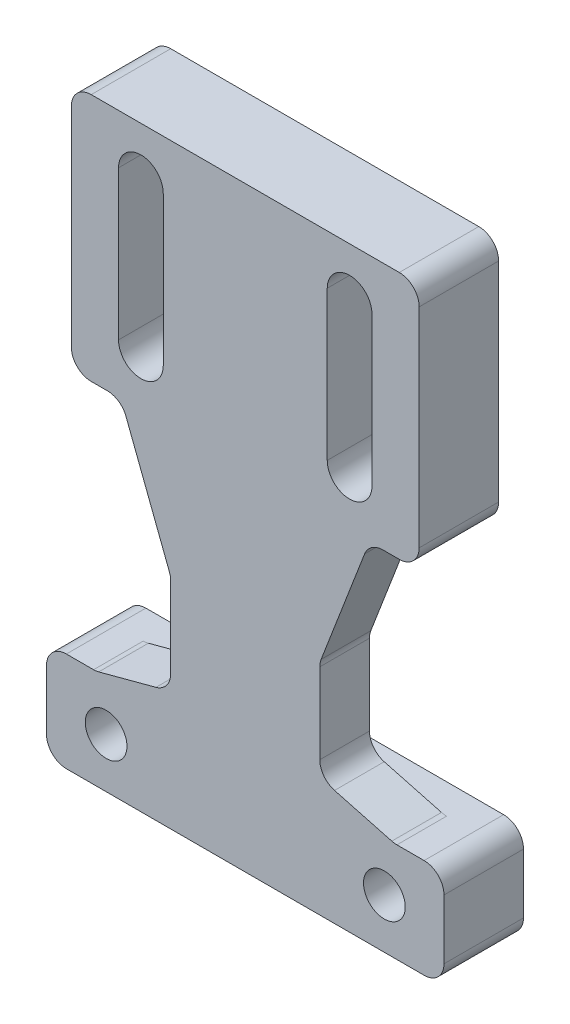
from build123d import *

# Parameters (mm, degrees)
EXTRUDE_1_DEPTH     = 8
FILLET_3_R          = 2
SKETCH_3_W          = 50
SKETCH_3_H          = 25
CUT_EXTRUDE_1_DEPTH = 3
M5X0_81_D           = 4.2
CUT_EXTRUDE_3_DEPTH = 73.553428589


with BuildPart() as part:
    # Эскиз2 → Бобышка-Вытянуть1 (new body)
    with BuildSketch(Plane.XY):
        Polygon((0, 0), (40, 0), (40, 10), (35, 10), (27.5, 12), (27.5, 22), (32.5, 35), (37.5, 35), (37.5, 60), (2.5, 60), (2.5, 35), (7.5, 35), (12.5, 22), (12.5, 12), (5, 10), (0, 10), align=None)
    extrude(amount=EXTRUDE_1_DEPTH)

    # Скругление3
    fillet_3_edges = [part.edges().sort_by_distance(p)[0] for p in [
        (0, 0, 4),
        (40, 0, 4),
        (37.5, 60, 4),
        (2.5, 60, 4),
        (32.5, 35, 4),
        (27.5, 22, 4),
        (27.5, 12, 4),
        (12.5, 12, 4),
        (12.5, 22, 4),
        (7.5, 35, 4),
        (2.5, 35, 4),
        (37.5, 35, 4),
        (0, 10, 4),
        (5, 10, 4),
        (35, 10, 4),
        (40, 10, 4),
    ]]
    fillet(fillet_3_edges, radius=FILLET_3_R)

    # Эскиз3 → Вырез-Вытянуть1 (cut)
    with BuildSketch(Plane(origin=(0, 0, 0), x_dir=(-1, 0, 0), z_dir=(0, 0, -1))):
        with Locations((-20, 22.5)):
            Rectangle(SKETCH_3_W, SKETCH_3_H)
    extrude(amount=-CUT_EXTRUDE_1_DEPTH, mode=Mode.SUBTRACT)

    # Отверстие обработанное метчиком M5x0.81 (through all)
    with Locations(Plane(origin=(0, 0, 0), x_dir=(-1, 0, 0), z_dir=(0, 0, -1))):
        with Locations((-34, 5), (-6, 5)):
            Hole(M5X0_81_D / 2)

    # Эскиз8 → Вырез-Вытянуть3 (cut, through all)
    with BuildSketch(Plane(origin=(0, 0, 0), x_dir=(-1, 0, 0), z_dir=(0, 0, -1))):
        with BuildLine():
            Line((-28.25, 55), (-28.25, 40))
            ThreePointArc((-28.25, 40), (-30.5, 37.75), (-32.75, 40))
            Line((-32.75, 40), (-32.75, 55))
            ThreePointArc((-32.75, 55), (-30.5, 57.25), (-28.25, 55))
        make_face()
        with BuildLine():
            Line((-11.75, 55), (-11.75, 40))
            ThreePointArc((-11.75, 40), (-9.5, 37.75), (-7.25, 40))
            Line((-7.25, 40), (-7.25, 55))
            ThreePointArc((-7.25, 55), (-9.5, 57.25), (-11.75, 55))
        make_face()
    extrude(amount=-CUT_EXTRUDE_3_DEPTH, mode=Mode.SUBTRACT)


solid = part.part
